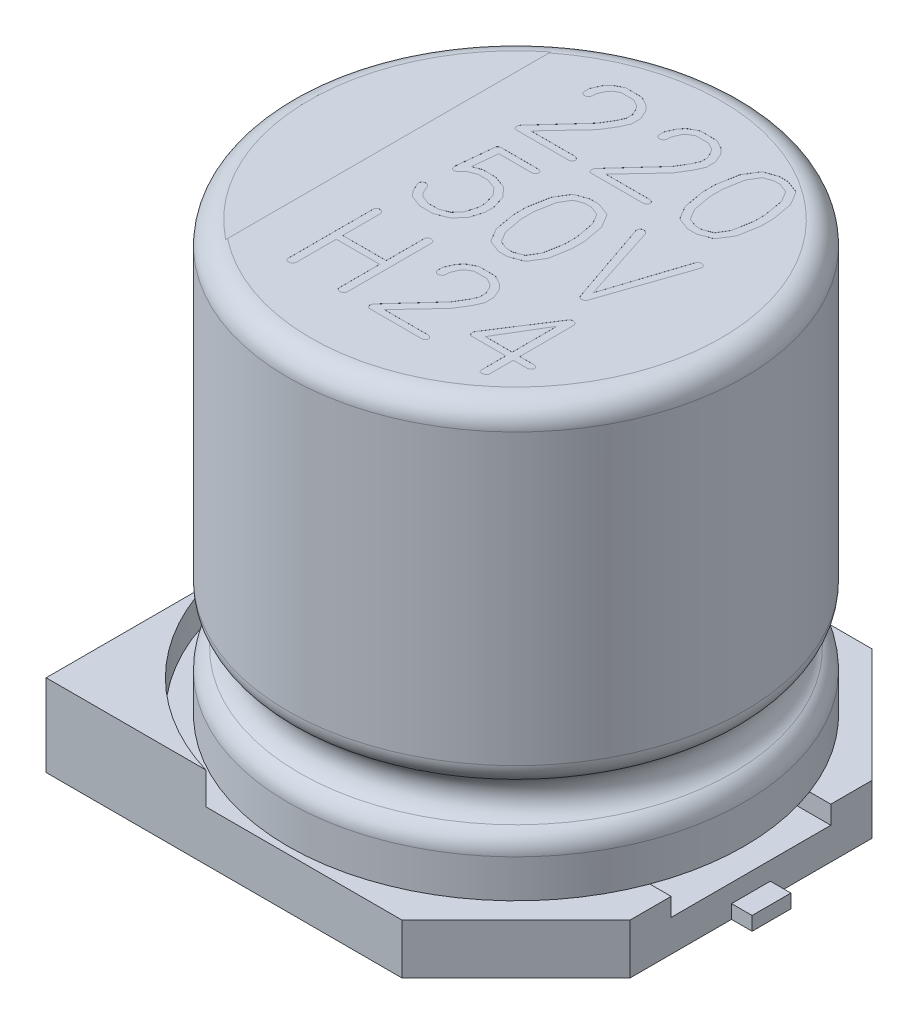
from build123d import *

# Parameters (mm, degrees)
BOSS_EXTRUDE1_DEPTH        = 1.1
BOSS_EXTRUDE2_DEPTH        = 0.7
CUT_EXTRUDE1_DEPTH         = 13.943734136
CUT_EXTRUDE1_DEPTH_BACK    = 13.943734136
SKETCH4_W                  = 3.5
SKETCH4_H                  = 0.4
BOSS_EXTRUDE3_DEPTH        = 0.001
BOSS_EXTRUDE3_DEPTH_BACK   = 0.3
SKETCH5_W                  = 3.35
SKETCH5_H                  = 0.85
BOSS_EXTRUDE3_2_DEPTH      = 0.001
BOSS_EXTRUDE3_2_DEPTH_BACK = 0.3
CUT_EXTRUDE2_START         = -0.001
CUT_EXTRUDE2_DEPTH         = 0.001
CUT_EXTRUDE3_START         = -0.001
CUT_EXTRUDE3_DEPTH         = 0.001


with BuildPart() as part:
    # Sketch1 → Revolve1 (revolve)
    with BuildSketch(Plane(origin=(0, 0, 0), x_dir=(0, 0, -1), z_dir=(1, 0, 0)), mode=Mode.PRIVATE) as revolve1_sk:
        with BuildLine():
            Line((0, 4.590029326), (5, 4.590029326))
            Line((5, 4.590029326), (5, -2.243945271))
            ThreePointArc((5, -2.243945271), (4.933012702, -2.493945271), (4.75, -2.676957973))
            ThreePointArc((4.75, -2.676957973), (4.5, -3.109970674), (4.75, -3.542983376))
            ThreePointArc((4.75, -3.542983376), (4.933012702, -3.725996078), (5, -3.975996078))
            Line((5, -3.975996078), (5, -4.809970674))
            Line((5, -4.809970674), (0, -4.809970674))
            Line((0, -4.809970674), (0, 4.590029326))
        make_face()
    revolve(revolve1_sk.sketch.rotate(Axis((0, 6.950146628, 0), (0, -1, 0)), 180), axis=Axis((0, 6.950146628, 0), (0, -1, 0)))

    # Sketch2 → Boss-Extrude1 (add)
    with BuildSketch(Plane.XZ.offset(4.809970674)):
        Polygon((2.65, 5.15), (5.15, 2.65), (5.15, -2.65), (2.65, -5.15), (-5.15, -5.15), (-5.15, 5.15), align=None)
    extrude(amount=BOSS_EXTRUDE1_DEPTH)

    # Sketch3 → Boss-Extrude2 (add)
    with BuildSketch(Plane(origin=(0, -4.809970674, 0), x_dir=(1, 0, 0), z_dir=(0, 1, 0))):
        with BuildLine():
            Line((-5.15, -5.15), (-1.65, -5.15))
            ThreePointArc((-1.65, -5.15), (-3.843149455, -3.843149455), (-5.15, -1.65))
            Line((-5.15, -1.65), (-5.15, -5.15))
        make_face()
        with BuildLine():
            Line((-5.15, 5.15), (-5.15, 1.65))
            ThreePointArc((-5.15, 1.65), (-3.843149455, 3.843149455), (-1.65, 5.15))
            Line((-1.65, 5.15), (-5.15, 5.15))
        make_face()
    extrude(amount=BOSS_EXTRUDE2_DEPTH)

    # Sketch4 → Cut-Extrude1 (cut, two sides: drawn at the far end of the back side and taken through both)
    with BuildSketch(Plane(origin=(5.15, 0, 0), x_dir=(0, 0, -1), z_dir=(1, 0, 0)).offset(-CUT_EXTRUDE1_DEPTH_BACK)):
        with Locations((0, -5.009970674)):
            Rectangle(SKETCH4_W, SKETCH4_H)
    extrude(amount=CUT_EXTRUDE1_DEPTH + CUT_EXTRUDE1_DEPTH_BACK, mode=Mode.SUBTRACT)

    # Cut-Extrude2: read off the stored shape, not the designer's step
    # Cut-Extrude2 outline → Cut-Extrude2 (cut)
    # profile 1 of 9: a face of its own
    with BuildSketch(Plane(origin=(0, 4.590029326, 0), x_dir=(1, 0, 0), z_dir=(0, 1, 0)).offset(CUT_EXTRUDE2_START)):
        with BuildLine():
            add(Edge.make_bspline(
                [(-1.525982751, 3.564360119), (-1.518792197, 3.571931364), (-1.505299119, 3.586138808), (-1.484513609, 3.604123833), (-1.464752492, 3.617720125), (-1.451181726, 3.6234541), (-1.44488156, 3.626116071)],
                knots=[0, 0, 0, 0, 0.304384541, 0.571177734, 0.800921238, 1, 1, 1, 1], degree=3))
            add(Edge.make_bspline(
                [(-1.592202989, 3.488839286), (-1.58095799, 3.501894963), (-1.559107364, 3.527263992), (-1.536806776, 3.552238335), (-1.525982751, 3.564360119)],
                knots=[0, 0, 0, 0, 0.514630515, 1, 1, 1, 1], degree=3))
            add(Edge.make_bspline(
                [(-1.682232751, 3.287946429), (-1.676555437, 3.300979254), (-1.66409458, 3.329584365), (-1.643126138, 3.375972423), (-1.619055668, 3.430021635), (-1.601537453, 3.468393234), (-1.592202989, 3.488839286)],
                knots=[0, 0, 0, 0, 0.193719621, 0.425185721, 0.69371404, 1, 1, 1, 1], degree=3))
            add(Edge.make_bspline(
                [(-1.684836918, 3.234747024), (-1.684124674, 3.24379513), (-1.682730777, 3.261502755), (-1.682396313, 3.279261776), (-1.682232751, 3.287946429)],
                knots=[0, 0, 0, 0, 0.510972331, 1, 1, 1, 1], degree=3))
            add(Edge.make_bspline(
                [(-1.68409287, 3.204613095), (-1.683599756, 3.20808455), (-1.682174437, 3.218118589), (-1.683784128, 3.228171861), (-1.684836918, 3.234747024)],
                knots=[0, 0, 0, 0, 0.345967863, 1, 1, 1, 1], degree=3))
            add(Edge.make_bspline(
                [(-1.65284287, 3.119047619), (-1.657723365, 3.123647913), (-1.667842725, 3.133186293), (-1.677938691, 3.153188853), (-1.683178097, 3.177549247), (-1.683773361, 3.195160323), (-1.68409287, 3.204613095)],
                knots=[0, 0, 0, 0, 0.212180223, 0.439940561, 0.699387238, 1, 1, 1, 1], degree=3))
            add(Edge.make_bspline(
                [(-1.605595846, 3.102306548), (-1.610700937, 3.102509605), (-1.620143534, 3.102885188), (-1.633281721, 3.105888469), (-1.644512112, 3.11093162), (-1.650117309, 3.11639232), (-1.65284287, 3.119047619)],
                knots=[0, 0, 0, 0, 0.29634935, 0.548140547, 0.78028056, 1, 1, 1, 1], degree=3))
            add(Edge.make_bspline(
                [(-1.563185132, 3.110119048), (-1.57107719, 3.108007272), (-1.585015314, 3.104277677), (-1.599369362, 3.102902898), (-1.605595846, 3.102306548)],
                knots=[0, 0, 0, 0, 0.566221034, 1, 1, 1, 1], degree=3))
            add(Edge.make_bspline(
                [(-1.509613703, 3.194940476), (-1.510196449, 3.186384391), (-1.511338172, 3.169621217), (-1.522430938, 3.14625684), (-1.539548309, 3.125527936), (-1.555037618, 3.115430427), (-1.563185132, 3.110119048)],
                knots=[0, 0, 0, 0, 0.242646645, 0.475395883, 0.724053578, 1, 1, 1, 1], degree=3))
            Line((-1.509613703, 3.194940476), (-1.509613703, 3.261904762))
            Line((-1.509613703, 3.261904762), (-1.441161322, 3.419270833))
            Line((-1.441161322, 3.419270833), (-1.380893465, 3.489583333))
            Line((-1.380893465, 3.489583333), (-1.258497632, 3.55952381))
            Line((-1.258497632, 3.55952381), (-0.982455965, 3.55952381))
            Line((-0.982455965, 3.55952381), (-0.845551203, 3.48735119))
            Line((-0.845551203, 3.48735119), (-0.784167275, 3.417782738))
            Line((-0.784167275, 3.417782738), (-0.714226798, 3.267485119))
            Line((-0.714226798, 3.267485119), (-0.714226798, 3.126488095))
            Line((-0.714226798, 3.126488095), (-0.780447037, 2.981026786))
            Line((-0.780447037, 2.981026786), (-0.935208941, 2.722470238))
            Line((-0.935208941, 2.722470238), (-1.73394406, 1.846354167))
            add(Edge.make_bspline(
                [(-1.761845846, 1.772693452), (-1.761500235, 1.779680605), (-1.76082952, 1.793240312), (-1.755218425, 1.812696808), (-1.746923429, 1.830961574), (-1.738296679, 1.841192276), (-1.73394406, 1.846354167)],
                knots=[0, 0, 0, 0, 0.259643066, 0.503879648, 0.749682982, 1, 1, 1, 1], degree=3))
            add(Edge.make_bspline(
                [(-1.708274418, 1.702380952), (-1.715485601, 1.705010054), (-1.729602386, 1.710156845), (-1.746294159, 1.726112702), (-1.757587406, 1.747500298), (-1.760353552, 1.76386496), (-1.761845846, 1.772693452)],
                knots=[0, 0, 0, 0, 0.242250914, 0.474236155, 0.716358213, 1, 1, 1, 1], degree=3))
            Line((-1.708274418, 1.702380952), (-0.564301203, 1.702380952))
            add(Edge.make_bspline(
                [(-0.486920251, 1.736235119), (-0.49202307, 1.730987703), (-0.502029526, 1.720697698), (-0.52100931, 1.710231599), (-0.541911655, 1.703609028), (-0.556683624, 1.70279878), (-0.564301203, 1.702380952)],
                knots=[0, 0, 0, 0, 0.250947582, 0.492099732, 0.738087023, 1, 1, 1, 1], degree=3))
            add(Edge.make_bspline(
                [(-0.473899418, 1.771205357), (-0.47567381, 1.765593256), (-0.479427973, 1.753719476), (-0.484333372, 1.74227199), (-0.486920251, 1.736235119)],
                knots=[0, 0, 0, 0, 0.472646552, 1, 1, 1, 1], degree=3))
            add(Edge.make_bspline(
                [(-0.553884537, 1.845238095), (-0.547509743, 1.843397621), (-0.53541896, 1.839906878), (-0.51902617, 1.832750331), (-0.505068654, 1.825031046), (-0.493630436, 1.816315211), (-0.484350072, 1.806758168), (-0.478488146, 1.795574246), (-0.474368851, 1.783771334), (-0.474058315, 1.775458779), (-0.473899418, 1.771205357)],
                knots=[0, 0, 0, 0, 0.16865006, 0.319870981, 0.454107496, 0.573381966, 0.685025493, 0.789529921, 0.892305297, 1, 1, 1, 1], degree=3))
            Line((-0.553884537, 1.845238095), (-1.517054179, 1.845238095))
            Line((-1.517054179, 1.845238095), (-0.810952989, 2.598958333))
            Line((-0.810952989, 2.598958333), (-0.635729775, 2.880580357))
            add(Edge.make_bspline(
                [(-0.547560132, 3.077008929), (-0.549418941, 3.072916089), (-0.553641582, 3.063618419), (-0.560814187, 3.04791595), (-0.569159211, 3.028544006), (-0.579891058, 3.005979208), (-0.591093973, 2.979431696), (-0.604668253, 2.949625493), (-0.619927133, 2.916382219), (-0.63030468, 2.892871244), (-0.635729775, 2.880580357)],
                knots=[0, 0, 0, 0, 0.062632263, 0.142281181, 0.240524556, 0.356495132, 0.49035439, 0.641931264, 0.812811584, 1, 1, 1, 1], degree=3))
            Line((-0.547560132, 3.077008929), (-0.547560132, 3.279761905))
            add(Edge.make_bspline(
                [(-0.616384537, 3.433779762), (-0.612397856, 3.425355804), (-0.603046302, 3.405595734), (-0.587542538, 3.371491755), (-0.568513894, 3.328606904), (-0.554961834, 3.297015901), (-0.547560132, 3.279761905)],
                knots=[0, 0, 0, 0, 0.165723618, 0.388737769, 0.666148108, 1, 1, 1, 1], degree=3))
            add(Edge.make_bspline(
                [(-0.739896441, 3.594866071), (-0.725998603, 3.579994215), (-0.699633651, 3.5517815), (-0.667792007, 3.517463885), (-0.645812578, 3.491334521), (-0.632641459, 3.472476206), (-0.622694925, 3.453326001), (-0.618447792, 3.440170634), (-0.616384537, 3.433779762)],
                knots=[0, 0, 0, 0, 0.298097896, 0.565507836, 0.685490914, 0.797822104, 0.901782062, 1, 1, 1, 1], degree=3))
            add(Edge.make_bspline(
                [(-0.937813108, 3.699776786), (-0.925814412, 3.693148113), (-0.898860864, 3.678257641), (-0.853426884, 3.654986195), (-0.799904874, 3.625792189), (-0.760900345, 3.605690703), (-0.739896441, 3.594866071)],
                knots=[0, 0, 0, 0, 0.183571618, 0.412370331, 0.683561953, 1, 1, 1, 1], degree=3))
            Line((-0.937813108, 3.699776786), (-1.291235727, 3.702380952))
            Line((-1.291235727, 3.702380952), (-1.310208941, 3.697916667))
            Line((-1.310208941, 3.697916667), (-1.44488156, 3.626116071))
        make_face()
    # profile 2 of 9: a face of its own
    with BuildSketch(Plane(origin=(0, 4.590029326, 0), x_dir=(1, 0, 0), z_dir=(0, 1, 0)).offset(CUT_EXTRUDE2_START)):
        with BuildLine():
            add(Edge.make_bspline(
                [(1.597529154, 1.202380952), (1.605195092, 1.201510642), (1.622143174, 1.199586533), (1.646358587, 1.188080402), (1.67011832, 1.174226748), (1.681770823, 1.160430388), (1.687186892, 1.154017857)],
                knots=[0, 0, 0, 0, 0.219777699, 0.485891046, 0.761042784, 1, 1, 1, 1], degree=3))
            add(Edge.make_bspline(
                [(1.539121416, 1.172991071), (1.544309427, 1.177537286), (1.553942879, 1.185979007), (1.569484449, 1.19479509), (1.583667679, 1.20110787), (1.593136367, 1.201977505), (1.597529154, 1.202380952)],
                knots=[0, 0, 0, 0, 0.30946402, 0.57463379, 0.802660857, 1, 1, 1, 1], degree=3))
            add(Edge.make_bspline(
                [(1.52386844, 1.105282738), (1.524130035, 1.11248228), (1.524619039, 1.125940486), (1.52691803, 1.144626949), (1.531585828, 1.160367985), (1.536724779, 1.168976393), (1.539121416, 1.172991071)],
                knots=[0, 0, 0, 0, 0.307017789, 0.573912696, 0.801286922, 1, 1, 1, 1], degree=3))
            Line((1.52386844, 1.105282738), (2.158169035, -0.74702381))
            add(Edge.make_bspline(
                [(2.224017249, -0.797619048), (2.216460088, -0.797010799), (2.20205104, -0.795851067), (2.182322329, -0.785791574), (2.167354362, -0.768774483), (2.161355039, -0.754568205), (2.158169035, -0.74702381)],
                knots=[0, 0, 0, 0, 0.253352165, 0.483060193, 0.725473614, 1, 1, 1, 1], degree=3))
            add(Edge.make_bspline(
                [(2.314791059, -0.757068452), (2.310465235, -0.763400703), (2.301690122, -0.776245937), (2.280307872, -0.789119586), (2.253886165, -0.796338004), (2.234489174, -0.797169919), (2.224017249, -0.797619048)],
                knots=[0, 0, 0, 0, 0.218396189, 0.443025726, 0.699304239, 1, 1, 1, 1], degree=3))
            Line((2.314791059, -0.757068452), (2.952439868, 1.110491071))
            add(Edge.make_bspline(
                [(2.946487487, 1.154761905), (2.948044496, 1.14834097), (2.951569676, 1.133803515), (2.952128094, 1.118843509), (2.952439868, 1.110491071)],
                knots=[0, 0, 0, 0, 0.441682214, 1, 1, 1, 1], degree=3))
            add(Edge.make_bspline(
                [(2.859433916, 1.202380952), (2.869694146, 1.200353859), (2.888646636, 1.196609453), (2.913962183, 1.186614364), (2.933954346, 1.172976167), (2.942451351, 1.160627573), (2.946487487, 1.154761905)],
                knots=[0, 0, 0, 0, 0.305527952, 0.564365036, 0.79307036, 1, 1, 1, 1], degree=3))
            add(Edge.make_bspline(
                [(2.792841654, 1.162574405), (2.796736024, 1.167594245), (2.804488034, 1.177586583), (2.819929252, 1.189522655), (2.838669358, 1.197619325), (2.852301498, 1.200745381), (2.859433916, 1.202380952)],
                knots=[0, 0, 0, 0, 0.238342879, 0.47443784, 0.725022705, 1, 1, 1, 1], degree=3))
            Line((2.792841654, 1.162574405), (2.237410106, -0.545386905))
            Line((2.237410106, -0.545386905), (1.687186892, 1.154017857))
        make_face()
    # profile 3 of 9: a face of its own
    with BuildSketch(Plane(origin=(0, 4.590029326, 0), x_dir=(1, 0, 0), z_dir=(0, 1, 0)).offset(CUT_EXTRUDE2_START)):
        with BuildLine():
            add(Edge.make_bspline(
                [(-1.701577989, -1.297619048), (-1.690169834, -1.298073941), (-1.668613436, -1.298933488), (-1.639174756, -1.310487714), (-1.614310855, -1.3283019), (-1.603374149, -1.345171148), (-1.597783346, -1.353794643)],
                knots=[0, 0, 0, 0, 0.274120724, 0.51796769, 0.753586925, 1, 1, 1, 1], degree=3))
            add(Edge.make_bspline(
                [(-1.761845846, -1.354910714), (-1.759259558, -1.347410478), (-1.754326272, -1.333103947), (-1.740941571, -1.315187299), (-1.722755878, -1.302929439), (-1.708810879, -1.299432707), (-1.701577989, -1.297619048)],
                knots=[0, 0, 0, 0, 0.269047248, 0.513201498, 0.747510944, 1, 1, 1, 1], degree=3))
            Line((-1.761845846, -1.354910714), (-1.761845846, -3.226190476))
            add(Edge.make_bspline(
                [(-1.690417275, -3.297619048), (-1.695666157, -3.297501573), (-1.705846431, -3.29727373), (-1.719935274, -3.292780938), (-1.732852484, -3.287050415), (-1.743164701, -3.277857726), (-1.751481187, -3.266958614), (-1.75737777, -3.254521201), (-1.761389834, -3.240820686), (-1.761690288, -3.231181233), (-1.761845846, -3.226190476)],
                knots=[0, 0, 0, 0, 0.137708227, 0.267086899, 0.387027622, 0.507635305, 0.626680935, 0.746621658, 0.868815193, 1, 1, 1, 1], degree=3))
            Line((-1.690417275, -3.297619048), (-1.657679179, -3.297619048))
            add(Edge.make_bspline(
                [(-1.595179179, -3.231026786), (-1.597180704, -3.237405572), (-1.601375044, -3.250772782), (-1.61539806, -3.268197488), (-1.634005295, -3.284674682), (-1.649401673, -3.293093087), (-1.657679179, -3.297619048)],
                knots=[0, 0, 0, 0, 0.211346888, 0.442892777, 0.700484198, 1, 1, 1, 1], degree=3))
            Line((-1.595179179, -3.231026786), (-1.595179179, -2.345238095))
            Line((-1.595179179, -2.345238095), (-0.642798227, -2.345238095))
            Line((-0.642798227, -2.345238095), (-0.642798227, -3.2265625))
            add(Edge.make_bspline(
                [(-0.571369656, -3.297619048), (-0.576227066, -3.297437827), (-0.585724303, -3.297083502), (-0.599364672, -3.293336302), (-0.611497026, -3.286601792), (-0.622714063, -3.278350461), (-0.631683762, -3.267437007), (-0.637913527, -3.254917829), (-0.642443211, -3.241253452), (-0.642677409, -3.231562074), (-0.642798227, -3.2265625)],
                knots=[0, 0, 0, 0, 0.129077934, 0.252373937, 0.371948458, 0.496693245, 0.620913156, 0.743411691, 0.867631603, 1, 1, 1, 1], degree=3))
            Line((-0.571369656, -3.297619048), (-0.537143465, -3.297619048))
            add(Edge.make_bspline(
                [(-0.47613156, -3.22953869), (-0.478100429, -3.236532144), (-0.48208727, -3.250693468), (-0.495574926, -3.269239906), (-0.51413073, -3.285296881), (-0.52913339, -3.293330054), (-0.537143465, -3.297619048)],
                knots=[0, 0, 0, 0, 0.228487027, 0.462672527, 0.713115322, 1, 1, 1, 1], degree=3))
            Line((-0.47613156, -3.22953869), (-0.47613156, -1.367931548))
            Line((-0.47613156, -1.367931548), (-0.483200013, -1.34375))
            add(Edge.make_bspline(
                [(-0.584018465, -1.297619048), (-0.57104476, -1.298070771), (-0.547837089, -1.298878825), (-0.517149419, -1.307066618), (-0.493736317, -1.321669243), (-0.486612925, -1.336597617), (-0.483200013, -1.34375)],
                knots=[0, 0, 0, 0, 0.32842445, 0.587493402, 0.802362594, 1, 1, 1, 1], degree=3))
            add(Edge.make_bspline(
                [(-0.642798227, -1.355654762), (-0.639957864, -1.348130927), (-0.634544214, -1.333790713), (-0.620761457, -1.316441287), (-0.604009111, -1.303343255), (-0.590790358, -1.29955814), (-0.584018465, -1.297619048)],
                knots=[0, 0, 0, 0, 0.276965208, 0.527887771, 0.758139562, 1, 1, 1, 1], degree=3))
            Line((-0.642798227, -1.355654762), (-0.642798227, -2.202380952))
            Line((-0.642798227, -2.202380952), (-1.595179179, -2.202380952))
            Line((-1.595179179, -2.202380952), (-1.595179179, -1.373511905))
            Line((-1.595179179, -1.373511905), (-1.597783346, -1.353794643))
        make_face()
    # profile 4 of 9: a face of its own
    with BuildSketch(Plane(origin=(0, 4.590029326, 0), x_dir=(1, 0, 0), z_dir=(0, 1, 0)).offset(CUT_EXTRUDE2_START)):
        with BuildLine():
            add(Edge.make_bspline(
                [(0.259731535, -1.435639881), (0.266922089, -1.428068636), (0.280415167, -1.413861192), (0.301200677, -1.395876167), (0.320961794, -1.382279875), (0.33453256, -1.3765459), (0.340832725, -1.373883929)],
                knots=[0, 0, 0, 0, 0.304384541, 0.571177734, 0.800921238, 1, 1, 1, 1], degree=3))
            add(Edge.make_bspline(
                [(0.193511297, -1.511160714), (0.204756296, -1.498105037), (0.226606921, -1.472736008), (0.24890751, -1.447761665), (0.259731535, -1.435639881)],
                knots=[0, 0, 0, 0, 0.514630515, 1, 1, 1, 1], degree=3))
            add(Edge.make_bspline(
                [(0.103481535, -1.712053571), (0.109158848, -1.699020746), (0.121619706, -1.670415635), (0.142588147, -1.624027577), (0.166658617, -1.569978365), (0.184176832, -1.531606766), (0.193511297, -1.511160714)],
                knots=[0, 0, 0, 0, 0.193719621, 0.425185721, 0.69371404, 1, 1, 1, 1], degree=3))
            add(Edge.make_bspline(
                [(0.100877368, -1.765252976), (0.101589611, -1.75620487), (0.102983509, -1.738497245), (0.103317973, -1.720738224), (0.103481535, -1.712053571)],
                knots=[0, 0, 0, 0, 0.510972331, 1, 1, 1, 1], degree=3))
            add(Edge.make_bspline(
                [(0.101621416, -1.795386905), (0.10211453, -1.79191545), (0.103539849, -1.781881411), (0.101930158, -1.771828139), (0.100877368, -1.765252976)],
                knots=[0, 0, 0, 0, 0.345967863, 1, 1, 1, 1], degree=3))
            add(Edge.make_bspline(
                [(0.132871416, -1.880952381), (0.12799092, -1.876352087), (0.117871561, -1.866813707), (0.107775594, -1.846811147), (0.102536189, -1.822450753), (0.101940925, -1.804839677), (0.101621416, -1.795386905)],
                knots=[0, 0, 0, 0, 0.212180223, 0.439940561, 0.699387238, 1, 1, 1, 1], degree=3))
            add(Edge.make_bspline(
                [(0.18011844, -1.897693452), (0.175013348, -1.897490395), (0.165570751, -1.897114812), (0.152432564, -1.894111531), (0.141202174, -1.88906838), (0.135596977, -1.88360768), (0.132871416, -1.880952381)],
                knots=[0, 0, 0, 0, 0.29634935, 0.548140547, 0.78028056, 1, 1, 1, 1], degree=3))
            add(Edge.make_bspline(
                [(0.222529154, -1.889880952), (0.214637095, -1.891992728), (0.200698972, -1.895722323), (0.186344924, -1.897097102), (0.18011844, -1.897693452)],
                knots=[0, 0, 0, 0, 0.566221034, 1, 1, 1, 1], degree=3))
            add(Edge.make_bspline(
                [(0.276100582, -1.805059524), (0.275517836, -1.813615609), (0.274376114, -1.830378783), (0.263283347, -1.85374316), (0.246165976, -1.874472064), (0.230676668, -1.884569573), (0.222529154, -1.889880952)],
                knots=[0, 0, 0, 0, 0.242646645, 0.475395883, 0.724053578, 1, 1, 1, 1], degree=3))
            Line((0.276100582, -1.805059524), (0.276100582, -1.738095238))
            Line((0.276100582, -1.738095238), (0.344552963, -1.580729167))
            Line((0.344552963, -1.580729167), (0.404820821, -1.510416667))
            Line((0.404820821, -1.510416667), (0.527216654, -1.44047619))
            Line((0.527216654, -1.44047619), (0.803258321, -1.44047619))
            Line((0.803258321, -1.44047619), (0.940163082, -1.51264881))
            Line((0.940163082, -1.51264881), (1.001547011, -1.582217262))
            Line((1.001547011, -1.582217262), (1.071487487, -1.732514881))
            Line((1.071487487, -1.732514881), (1.071487487, -1.873511905))
            Line((1.071487487, -1.873511905), (1.005267249, -2.018973214))
            Line((1.005267249, -2.018973214), (0.850505344, -2.277529762))
            Line((0.850505344, -2.277529762), (0.051770225, -3.153645833))
            add(Edge.make_bspline(
                [(0.02386844, -3.227306548), (0.024214051, -3.220319395), (0.024884766, -3.206759688), (0.030495861, -3.187303192), (0.038790856, -3.169038426), (0.047417607, -3.158807724), (0.051770225, -3.153645833)],
                knots=[0, 0, 0, 0, 0.259643066, 0.503879648, 0.749682982, 1, 1, 1, 1], degree=3))
            add(Edge.make_bspline(
                [(0.077439868, -3.297619048), (0.070228684, -3.294989946), (0.0561119, -3.289843155), (0.039420127, -3.273887298), (0.028126879, -3.252499702), (0.025360734, -3.23613504), (0.02386844, -3.227306548)],
                knots=[0, 0, 0, 0, 0.242250914, 0.474236155, 0.716358213, 1, 1, 1, 1], degree=3))
            Line((0.077439868, -3.297619048), (1.221413082, -3.297619048))
            add(Edge.make_bspline(
                [(1.298794035, -3.263764881), (1.293691216, -3.269012297), (1.28368476, -3.279302302), (1.264704976, -3.289768401), (1.243802631, -3.296390972), (1.229030662, -3.29720122), (1.221413082, -3.297619048)],
                knots=[0, 0, 0, 0, 0.250947582, 0.492099732, 0.738087023, 1, 1, 1, 1], degree=3))
            add(Edge.make_bspline(
                [(1.311814868, -3.228794643), (1.310040476, -3.234406744), (1.306286312, -3.246280524), (1.301380914, -3.25772801), (1.298794035, -3.263764881)],
                knots=[0, 0, 0, 0, 0.472646552, 1, 1, 1, 1], degree=3))
            add(Edge.make_bspline(
                [(1.231829749, -3.154761905), (1.238204542, -3.156602379), (1.250295326, -3.160093122), (1.266688115, -3.167249669), (1.280645632, -3.174968954), (1.29208385, -3.183684789), (1.301364214, -3.193241832), (1.307226139, -3.204425754), (1.311345435, -3.216228666), (1.311655971, -3.224541221), (1.311814868, -3.228794643)],
                knots=[0, 0, 0, 0, 0.16865006, 0.319870981, 0.454107496, 0.573381966, 0.685025493, 0.789529921, 0.892305297, 1, 1, 1, 1], degree=3))
            Line((1.231829749, -3.154761905), (0.268660106, -3.154761905))
            Line((0.268660106, -3.154761905), (0.974761297, -2.401041667))
            Line((0.974761297, -2.401041667), (1.149984511, -2.119419643))
            add(Edge.make_bspline(
                [(1.238154154, -1.922991071), (1.236295345, -1.927083911), (1.232072704, -1.936381581), (1.224900099, -1.95208405), (1.216555075, -1.971455994), (1.205823228, -1.994020792), (1.194620313, -2.020568304), (1.181046033, -2.050374507), (1.165787153, -2.083617781), (1.155409605, -2.107128756), (1.149984511, -2.119419643)],
                knots=[0, 0, 0, 0, 0.062632263, 0.142281181, 0.240524556, 0.356495132, 0.49035439, 0.641931264, 0.812811584, 1, 1, 1, 1], degree=3))
            Line((1.238154154, -1.922991071), (1.238154154, -1.720238095))
            add(Edge.make_bspline(
                [(1.169329749, -1.566220238), (1.17331643, -1.574644196), (1.182667984, -1.594404266), (1.198171747, -1.628508245), (1.217200392, -1.671393096), (1.230752452, -1.702984099), (1.238154154, -1.720238095)],
                knots=[0, 0, 0, 0, 0.165723618, 0.388737769, 0.666148108, 1, 1, 1, 1], degree=3))
            add(Edge.make_bspline(
                [(1.045817844, -1.405133929), (1.059715683, -1.420005785), (1.086080635, -1.4482185), (1.117922279, -1.482536115), (1.139901708, -1.508665479), (1.153072827, -1.527523794), (1.16301936, -1.546673999), (1.167266494, -1.559829366), (1.169329749, -1.566220238)],
                knots=[0, 0, 0, 0, 0.298097896, 0.565507836, 0.685490914, 0.797822104, 0.901782062, 1, 1, 1, 1], degree=3))
            add(Edge.make_bspline(
                [(0.847901178, -1.300223214), (0.859899874, -1.306851887), (0.886853422, -1.321742359), (0.932287402, -1.345013805), (0.985809411, -1.374207811), (1.024813941, -1.394309297), (1.045817844, -1.405133929)],
                knots=[0, 0, 0, 0, 0.183571618, 0.412370331, 0.683561953, 1, 1, 1, 1], degree=3))
            Line((0.847901178, -1.300223214), (0.494478559, -1.297619048))
            Line((0.494478559, -1.297619048), (0.475505344, -1.302083333))
            Line((0.475505344, -1.302083333), (0.340832725, -1.373883929))
        make_face()
    # profile 5 of 9: a face of its own
    with BuildSketch(Plane(origin=(0, 4.590029326, 0), x_dir=(1, 0, 0), z_dir=(0, 1, 0)).offset(CUT_EXTRUDE2_START)):
        with BuildLine():
            add(Edge.make_bspline(
                [(2.567023202, -1.301339286), (2.575435415, -1.303393494), (2.590708377, -1.307123053), (2.610383599, -1.316396685), (2.625007323, -1.328396646), (2.629837523, -1.338812278), (2.632127368, -1.34375)],
                knots=[0, 0, 0, 0, 0.319425048, 0.579938577, 0.800862167, 1, 1, 1, 1], degree=3))
            add(Edge.make_bspline(
                [(2.544329749, -1.297619048), (2.548067821, -1.297881172), (2.555746168, -1.298419601), (2.563198771, -1.30034912), (2.567023202, -1.301339286)],
                knots=[0, 0, 0, 0, 0.486832981, 1, 1, 1, 1], degree=3))
            add(Edge.make_bspline(
                [(2.490014273, -1.321056548), (2.494607941, -1.31739814), (2.503249464, -1.31051601), (2.517381753, -1.303514123), (2.53085311, -1.298538959), (2.539950232, -1.297917992), (2.544329749, -1.297619048)],
                knots=[0, 0, 0, 0, 0.291422228, 0.548218157, 0.782504151, 1, 1, 1, 1], degree=3))
            Line((2.490014273, -1.321056548), (1.777216654, -2.424479167))
            Line((1.777216654, -2.424479167), (1.682722606, -2.569196429))
            add(Edge.make_bspline(
                [(1.666725582, -2.622395833), (1.667460124, -2.61303076), (1.668941442, -2.594144629), (1.678103661, -2.577558159), (1.682722606, -2.569196429)],
                knots=[0, 0, 0, 0, 0.495870391, 1, 1, 1, 1], degree=3))
            Line((1.666725582, -2.622395833), (1.667097606, -2.641741071))
            add(Edge.make_bspline(
                [(1.72996963, -2.702380952), (1.722336809, -2.70063445), (1.707606372, -2.697263908), (1.688780793, -2.684101195), (1.674719306, -2.665148629), (1.669750255, -2.649887814), (1.667097606, -2.641741071)],
                knots=[0, 0, 0, 0, 0.250968066, 0.484338532, 0.724722342, 1, 1, 1, 1], degree=3))
            Line((1.72996963, -2.702380952), (2.476249392, -2.702380952))
            Line((2.476249392, -2.702380952), (2.476249392, -3.227306548))
            add(Edge.make_bspline(
                [(2.547677963, -3.297619048), (2.542080765, -3.29743092), (2.531516196, -3.297075834), (2.516709512, -3.293767171), (2.504242461, -3.288106724), (2.493593115, -3.280556372), (2.485833885, -3.270183129), (2.480031831, -3.257808551), (2.476833133, -3.243213319), (2.476450159, -3.232777395), (2.476249392, -3.227306548)],
                knots=[0, 0, 0, 0, 0.146120685, 0.275799037, 0.393243869, 0.502107596, 0.612930406, 0.727433559, 0.857111911, 1, 1, 1, 1], degree=3))
            add(Edge.make_bspline(
                [(2.642916059, -3.230282738), (2.641079136, -3.236228551), (2.637539625, -3.247685357), (2.627894907, -3.262605388), (2.615302097, -3.274614836), (2.595735182, -3.284698298), (2.573227349, -3.293343301), (2.555296368, -3.296344091), (2.547677963, -3.297619048)],
                knots=[0, 0, 0, 0, 0.149231329, 0.287549313, 0.422738116, 0.56310347, 0.814374114, 1, 1, 1, 1], degree=3))
            Line((2.642916059, -3.230282738), (2.642916059, -2.702380952))
            Line((2.642916059, -2.702380952), (2.958764273, -2.702380952))
            Line((2.958764273, -2.702380952), (2.986666059, -2.692708333))
            add(Edge.make_bspline(
                [(3.034285106, -2.619047619), (3.033695094, -2.626200485), (3.032522236, -2.640419329), (3.023345797, -2.660842745), (3.007386254, -2.678460873), (2.993833201, -2.687780118), (2.986666059, -2.692708333)],
                knots=[0, 0, 0, 0, 0.233231212, 0.463629264, 0.716355746, 1, 1, 1, 1], degree=3))
            add(Edge.make_bspline(
                [(2.954672011, -2.559895833), (2.965470744, -2.561873429), (2.985185017, -2.565483748), (3.01074384, -2.577495638), (3.028192263, -2.596202576), (3.032258537, -2.61144902), (3.034285106, -2.619047619)],
                knots=[0, 0, 0, 0, 0.307809079, 0.561939283, 0.781677093, 1, 1, 1, 1], degree=3))
            Line((2.954672011, -2.559895833), (2.642916059, -2.55952381))
            Line((2.642916059, -2.55952381), (2.642916059, -1.372395833))
            Line((2.642916059, -1.372395833), (2.632127368, -1.34375))
        make_face()
        Polygon((1.887707725, -2.55952381), (2.476249392, -1.578125), (2.476249392, -2.55952381), align=None, mode=Mode.SUBTRACT)
    # profile 6 of 9: a face of its own
    with BuildSketch(Plane(origin=(0, 4.590029326, 0), x_dir=(1, 0, 0), z_dir=(0, 1, 0)).offset(CUT_EXTRUDE2_START)):
        with BuildLine():
            add(Edge.make_bspline(
                [(0.157052963, 1.10639881), (0.165864418, 1.109229974), (0.185017826, 1.115384061), (0.216147091, 1.125924002), (0.252120092, 1.138548748), (0.29143613, 1.152802089), (0.330546948, 1.167729843), (0.366736381, 1.180379758), (0.397529644, 1.192234398), (0.416587686, 1.198946712), (0.42528213, 1.202008929)],
                knots=[0, 0, 0, 0, 0.097494295, 0.211922795, 0.346195072, 0.499096622, 0.652449514, 0.787159544, 0.902900332, 1, 1, 1, 1], degree=3))
            Line((0.157052963, 1.10639881), (0.136963678, 1.087425595))
            Line((0.136963678, 1.087425595), (-0.028958941, 0.819568452))
            Line((-0.028958941, 0.819568452), (-0.038259537, 0.797991071))
            Line((-0.038259537, 0.797991071), (-0.118988703, 0.350074405))
            Line((-0.118988703, 0.350074405), (-0.118988703, 0.062872024))
            Line((-0.118988703, 0.062872024), (-0.039375608, -0.383184524))
            Line((-0.039375608, -0.383184524), (-0.032679179, -0.404017857))
            Line((-0.032679179, -0.404017857), (0.132127368, -0.680803571))
            Line((0.132127368, -0.680803571), (0.154448797, -0.701264881))
            add(Edge.make_bspline(
                [(0.413377368, -0.797619048), (0.405556448, -0.794914514), (0.389134217, -0.789235583), (0.363285859, -0.779740427), (0.334820341, -0.769508299), (0.303759318, -0.757798805), (0.270170037, -0.745229261), (0.233742027, -0.731838215), (0.194957871, -0.716997359), (0.168209091, -0.706608956), (0.154448797, -0.701264881)],
                knots=[0, 0, 0, 0, 0.089853612, 0.188673046, 0.298996415, 0.418297397, 0.549102946, 0.688419437, 0.839714544, 1, 1, 1, 1], degree=3))
            Line((0.413377368, -0.797619048), (0.616874392, -0.797619048))
            add(Edge.make_bspline(
                [(0.885847606, -0.698660714), (0.875536511, -0.701828188), (0.853828606, -0.708496658), (0.819908363, -0.720227868), (0.782875079, -0.733422269), (0.74438905, -0.748479631), (0.706666116, -0.762798309), (0.672352909, -0.775718318), (0.643037806, -0.787320898), (0.62505981, -0.794397195), (0.616874392, -0.797619048)],
                knots=[0, 0, 0, 0, 0.112872702, 0.237630425, 0.375556633, 0.524258636, 0.670072947, 0.797812071, 0.907943434, 1, 1, 1, 1], degree=3))
            Line((0.885847606, -0.698660714), (0.90184463, -0.685639881))
            Line((0.90184463, -0.685639881), (1.074835702, -0.410714286))
            Line((1.074835702, -0.410714286), (1.087112487, -0.386160714))
            Line((1.087112487, -0.386160714), (1.166725582, 0.05766369))
            Line((1.166725582, 0.05766369), (1.166725582, 0.333333333))
            Line((1.166725582, 0.333333333), (1.087112487, 0.777157738))
            Line((1.087112487, 0.777157738), (1.077439868, 0.803571429))
            Line((1.077439868, 0.803571429), (0.917097606, 1.0703125))
            Line((0.917097606, 1.0703125), (0.891799987, 1.09858631))
            add(Edge.make_bspline(
                [(0.620222606, 1.199032738), (0.627775471, 1.196026315), (0.643824223, 1.189638099), (0.669862465, 1.18003215), (0.698885033, 1.168802146), (0.731353043, 1.157045892), (0.766774399, 1.143903747), (0.805476501, 1.129797822), (0.847512301, 1.114536767), (0.876668595, 1.104035965), (0.891799987, 1.09858631)],
                knots=[0, 0, 0, 0, 0.084217719, 0.178950538, 0.287518157, 0.406613068, 0.536684742, 0.678939248, 0.833377444, 1, 1, 1, 1], degree=3))
            Line((0.620222606, 1.199032738), (0.42528213, 1.202008929))
        make_face()
        Polygon((1.000058916, 0.072544643), (0.92528213, -0.348958333), (0.785773202, -0.578497024), (0.583764273, -0.654761905), (0.444627368, -0.654761905), (0.263823797, -0.586681548), (0.124686892, -0.355282738), (0.047677963, 0.069568452), (0.047677963, 0.341889881), (0.123198797, 0.764136905), (0.26121963, 0.990699405), (0.447231535, 1.05952381), (0.584880344, 1.05952381), (0.783913082, 0.98735119), (0.922677963, 0.756324405), (1.000058916, 0.321056548), align=None, mode=Mode.SUBTRACT)
    # profile 7 of 9: a face of its own
    with BuildSketch(Plane(origin=(0, 4.590029326, 0), x_dir=(1, 0, 0), z_dir=(0, 1, 0)).offset(CUT_EXTRUDE2_START)):
        with BuildLine():
            add(Edge.make_bspline(
                [(-1.600387513, 1.143229167), (-1.599121975, 1.149980129), (-1.596627001, 1.163289471), (-1.584213642, 1.180750355), (-1.565603758, 1.194417125), (-1.550248422, 1.199593527), (-1.541979775, 1.202380952)],
                knots=[0, 0, 0, 0, 0.230250674, 0.453933059, 0.705950109, 1, 1, 1, 1], degree=3))
            Line((-1.600387513, 1.143229167), (-1.684836918, 0.325892857))
            Line((-1.684836918, 0.325892857), (-1.676652394, 0.296130952))
            add(Edge.make_bspline(
                [(-1.624197037, 0.248511905), (-1.630132069, 0.250898585), (-1.641696387, 0.255548995), (-1.656947786, 0.266052385), (-1.668866199, 0.279851634), (-1.674034505, 0.290657489), (-1.676652394, 0.296130952)],
                knots=[0, 0, 0, 0, 0.261872693, 0.510254856, 0.751930596, 1, 1, 1, 1], degree=3))
            add(Edge.make_bspline(
                [(-1.547560132, 0.264136905), (-1.551439983, 0.261707205), (-1.560269642, 0.25617776), (-1.577622488, 0.251994118), (-1.599282433, 0.249048158), (-1.615374274, 0.248701803), (-1.624197037, 0.248511905)],
                knots=[0, 0, 0, 0, 0.172235807, 0.391969579, 0.666631786, 1, 1, 1, 1], degree=3))
            Line((-1.547560132, 0.264136905), (-1.461994656, 0.365699405))
            Line((-1.461994656, 0.365699405), (-1.27300656, 0.44047619))
            Line((-1.27300656, 0.44047619), (-1.060208941, 0.44047619))
            Line((-1.060208941, 0.44047619), (-0.847411322, 0.361979167))
            Line((-0.847411322, 0.361979167), (-0.713110727, 0.211309524))
            Line((-0.713110727, 0.211309524), (-0.642798227, -0.028645833))
            Line((-0.642798227, -0.028645833), (-0.642798227, -0.183407738))
            Line((-0.642798227, -0.183407738), (-0.71534287, -0.425967262))
            Line((-0.71534287, -0.425967262), (-0.849643465, -0.577008929))
            Line((-0.849643465, -0.577008929), (-1.05425656, -0.654761905))
            Line((-1.05425656, -0.654761905), (-1.27300656, -0.654761905))
            Line((-1.27300656, -0.654761905), (-1.462738703, -0.582589286))
            Line((-1.462738703, -0.582589286), (-1.521890489, -0.517857143))
            Line((-1.521890489, -0.517857143), (-1.594435132, -0.351190476))
            add(Edge.make_bspline(
                [(-1.664747632, -0.295014881), (-1.656192627, -0.298347727), (-1.640252986, -0.304557467), (-1.619490457, -0.317233336), (-1.603776703, -0.332768732), (-1.597491167, -0.345163921), (-1.594435132, -0.351190476)],
                knots=[0, 0, 0, 0, 0.296626607, 0.552673144, 0.782509187, 1, 1, 1, 1], degree=3))
            add(Edge.make_bspline(
                [(-1.742872632, -0.319940476), (-1.737540532, -0.316130124), (-1.726814291, -0.308465085), (-1.707944674, -0.300652363), (-1.687079262, -0.295702598), (-1.672342326, -0.295248764), (-1.664747632, -0.295014881)],
                knots=[0, 0, 0, 0, 0.234598074, 0.471925834, 0.727856446, 1, 1, 1, 1], degree=3))
            add(Edge.make_bspline(
                [(-1.761845846, -0.373883929), (-1.761673771, -0.368649803), (-1.761337163, -0.358410941), (-1.757504453, -0.343932273), (-1.751568465, -0.330829219), (-1.745761551, -0.323557921), (-1.742872632, -0.319940476)],
                knots=[0, 0, 0, 0, 0.267945949, 0.524149023, 0.763265871, 1, 1, 1, 1], degree=3))
            Line((-1.761845846, -0.373883929), (-1.761845846, -0.395089286))
            Line((-1.761845846, -0.395089286), (-1.671072037, -0.589657738))
            add(Edge.make_bspline(
                [(-1.562813108, -0.702752976), (-1.564574671, -0.701292353), (-1.569038349, -0.697591238), (-1.576258952, -0.689903803), (-1.586364907, -0.680051104), (-1.598696397, -0.667321197), (-1.613086176, -0.651592774), (-1.630225945, -0.633387677), (-1.65004524, -0.61264208), (-1.663785696, -0.59762242), (-1.671072037, -0.589657738)],
                knots=[0, 0, 0, 0, 0.043802275, 0.110991898, 0.201697889, 0.314253043, 0.450405316, 0.610060218, 0.793221274, 1, 1, 1, 1], degree=3))
            add(Edge.make_bspline(
                [(-1.310208941, -0.797619048), (-1.317794087, -0.795072263), (-1.333787242, -0.78970241), (-1.358715449, -0.779971996), (-1.386632927, -0.770394424), (-1.416750195, -0.758398816), (-1.44978164, -0.746450929), (-1.48527682, -0.733002113), (-1.523066301, -0.717964723), (-1.549284318, -0.707930663), (-1.562813108, -0.702752976)],
                knots=[0, 0, 0, 0, 0.088940656, 0.187529925, 0.29742365, 0.416991922, 0.547853359, 0.687912087, 0.838959148, 1, 1, 1, 1], degree=3))
            Line((-1.310208941, -0.797619048), (-1.025238703, -0.797619048))
            add(Edge.make_bspline(
                [(-0.748825013, -0.692708333), (-0.759478011, -0.697077442), (-0.781828277, -0.706243944), (-0.817124465, -0.720023592), (-0.855737199, -0.734057331), (-0.896128134, -0.748062956), (-0.935298782, -0.761321344), (-0.970047428, -0.774809228), (-0.999818659, -0.785692772), (-1.017346876, -0.793916454), (-1.025238703, -0.797619048)],
                knots=[0, 0, 0, 0, 0.116794095, 0.245037022, 0.384316554, 0.533497011, 0.678700039, 0.803693884, 0.911616005, 1, 1, 1, 1], degree=3))
            add(Edge.make_bspline(
                [(-0.561697037, -0.484002976), (-0.564428392, -0.487224435), (-0.571256782, -0.495278081), (-0.583432343, -0.509857592), (-0.600382303, -0.528775326), (-0.621437846, -0.552594306), (-0.647256313, -0.580859201), (-0.677378274, -0.613867263), (-0.711472236, -0.651922162), (-0.735900864, -0.678596222), (-0.748825013, -0.692708333)],
                knots=[0, 0, 0, 0, 0.045199087, 0.112997717, 0.203259411, 0.316995048, 0.453220782, 0.612924467, 0.795214783, 1, 1, 1, 1], degree=3))
            add(Edge.make_bspline(
                [(-0.47613156, -0.204241071), (-0.484588214, -0.231019215), (-0.500746312, -0.282184121), (-0.523508378, -0.355577001), (-0.54359505, -0.4220484), (-0.555897307, -0.464153232), (-0.561697037, -0.484002976)],
                knots=[0, 0, 0, 0, 0.287956289, 0.550197083, 0.787946597, 1, 1, 1, 1], degree=3))
            Line((-0.47613156, -0.204241071), (-0.47613156, -0.010044643))
            add(Edge.make_bspline(
                [(-0.563929179, 0.274181548), (-0.561437063, 0.266000607), (-0.555777886, 0.247423068), (-0.546654248, 0.216368166), (-0.535273791, 0.179143554), (-0.523446571, 0.137307349), (-0.510496709, 0.094946912), (-0.498311797, 0.055607229), (-0.487183907, 0.021073865), (-0.479649524, -0.000139616), (-0.47613156, -0.010044643)],
                knots=[0, 0, 0, 0, 0.086235027, 0.195825213, 0.326374958, 0.478728615, 0.63419102, 0.773012364, 0.894014625, 1, 1, 1, 1], degree=3))
            add(Edge.make_bspline(
                [(-0.752917275, 0.482514881), (-0.721051185, 0.448882194), (-0.656549199, 0.380804337), (-0.595047187, 0.310004135), (-0.563929179, 0.274181548)],
                knots=[0, 0, 0, 0, 0.494032697, 1, 1, 1, 1], degree=3))
            add(Edge.make_bspline(
                [(-1.022634537, 0.580357143), (-1.015084714, 0.577342522), (-0.998934556, 0.570893813), (-0.972879294, 0.561458744), (-0.943866916, 0.55044127), (-0.911497175, 0.539134954), (-0.876180905, 0.526414619), (-0.837844629, 0.512699309), (-0.796529976, 0.497650034), (-0.767812184, 0.487683942), (-0.752917275, 0.482514881)],
                knots=[0, 0, 0, 0, 0.084991788, 0.181809691, 0.289705401, 0.409453548, 0.540278176, 0.682179498, 0.835157683, 1, 1, 1, 1], degree=3))
            Line((-1.022634537, 0.580357143), (-1.305000608, 0.58296131))
            Line((-1.305000608, 0.58296131), (-1.493336766, 0.514909576))
            Line((-1.493336766, 0.514909576), (-1.445253584, 0.970982143))
            Line((-1.445253584, 0.970982143), (-1.437441084, 1.05952381))
            Line((-1.437441084, 1.05952381), (-0.712738703, 1.05952381))
            Line((-0.712738703, 1.05952381), (-0.68706906, 1.06547619))
            add(Edge.make_bspline(
                [(-0.634985727, 1.142113095), (-0.635585764, 1.134054768), (-0.636750614, 1.118411149), (-0.647382165, 1.096740741), (-0.664273592, 1.078337474), (-0.679206824, 1.069912092), (-0.68706906, 1.06547619)],
                knots=[0, 0, 0, 0, 0.245756713, 0.477087105, 0.724690207, 1, 1, 1, 1], degree=3))
            add(Edge.make_bspline(
                [(-0.708646441, 1.20014881), (-0.697665379, 1.19699393), (-0.678099562, 1.191372633), (-0.654291212, 1.178182306), (-0.637746898, 1.161855082), (-0.635873699, 1.148461975), (-0.634985727, 1.142113095)],
                knots=[0, 0, 0, 0, 0.339877313, 0.60558599, 0.81303166, 1, 1, 1, 1], degree=3))
            Line((-0.708646441, 1.20014881), (-1.541979775, 1.202380952))
        make_face()
    # profile 8 of 9: a face of its own
    with BuildSketch(Plane(origin=(0, 4.590029326, 0), x_dir=(1, 0, 0), z_dir=(0, 1, 0)).offset(CUT_EXTRUDE2_START)):
        with BuildLine():
            add(Edge.make_bspline(
                [(1.799910106, 3.60639881), (1.80872156, 3.609229974), (1.827874968, 3.615384061), (1.859004234, 3.625924002), (1.894977235, 3.638548748), (1.934293273, 3.652802089), (1.973404091, 3.667729843), (2.009593524, 3.680379758), (2.040386787, 3.692234398), (2.059444828, 3.698946712), (2.068139273, 3.702008929)],
                knots=[0, 0, 0, 0, 0.097494295, 0.211922795, 0.346195072, 0.499096622, 0.652449514, 0.787159544, 0.902900332, 1, 1, 1, 1], degree=3))
            Line((1.799910106, 3.60639881), (1.779820821, 3.587425595))
            Line((1.779820821, 3.587425595), (1.613898202, 3.319568452))
            Line((1.613898202, 3.319568452), (1.604597606, 3.297991071))
            Line((1.604597606, 3.297991071), (1.52386844, 2.850074405))
            Line((1.52386844, 2.850074405), (1.52386844, 2.562872024))
            Line((1.52386844, 2.562872024), (1.603481535, 2.116815476))
            Line((1.603481535, 2.116815476), (1.610177963, 2.095982143))
            Line((1.610177963, 2.095982143), (1.774984511, 1.819196429))
            Line((1.774984511, 1.819196429), (1.79730594, 1.798735119))
            add(Edge.make_bspline(
                [(2.056234511, 1.702380952), (2.048413591, 1.705085486), (2.03199136, 1.710764417), (2.006143002, 1.720259573), (1.977677484, 1.730491701), (1.946616461, 1.742201195), (1.91302718, 1.754770739), (1.87659917, 1.768161785), (1.837815014, 1.783002641), (1.811066234, 1.793391044), (1.79730594, 1.798735119)],
                knots=[0, 0, 0, 0, 0.089853612, 0.188673046, 0.298996415, 0.418297397, 0.549102946, 0.688419437, 0.839714544, 1, 1, 1, 1], degree=3))
            Line((2.056234511, 1.702380952), (2.259731535, 1.702380952))
            add(Edge.make_bspline(
                [(2.528704749, 1.801339286), (2.518393654, 1.798171812), (2.496685749, 1.791503342), (2.462765506, 1.779772132), (2.425732222, 1.766577731), (2.387246193, 1.751520369), (2.349523259, 1.737201691), (2.315210051, 1.724281682), (2.285894949, 1.712679102), (2.267916952, 1.705602805), (2.259731535, 1.702380952)],
                knots=[0, 0, 0, 0, 0.112872702, 0.237630425, 0.375556633, 0.524258636, 0.670072947, 0.797812071, 0.907943434, 1, 1, 1, 1], degree=3))
            Line((2.528704749, 1.801339286), (2.544701773, 1.814360119))
            Line((2.544701773, 1.814360119), (2.717692844, 2.089285714))
            Line((2.717692844, 2.089285714), (2.72996963, 2.113839286))
            Line((2.72996963, 2.113839286), (2.809582725, 2.55766369))
            Line((2.809582725, 2.55766369), (2.809582725, 2.833333333))
            Line((2.809582725, 2.833333333), (2.72996963, 3.277157738))
            Line((2.72996963, 3.277157738), (2.720297011, 3.303571429))
            Line((2.720297011, 3.303571429), (2.559954749, 3.5703125))
            Line((2.559954749, 3.5703125), (2.53465713, 3.59858631))
            add(Edge.make_bspline(
                [(2.263079749, 3.699032738), (2.270632614, 3.696026315), (2.286681366, 3.689638099), (2.312719608, 3.68003215), (2.341742176, 3.668802146), (2.374210186, 3.657045892), (2.409631542, 3.643903747), (2.448333644, 3.629797822), (2.490369444, 3.614536767), (2.519525738, 3.604035965), (2.53465713, 3.59858631)],
                knots=[0, 0, 0, 0, 0.084217719, 0.178950538, 0.287518157, 0.406613068, 0.536684742, 0.678939248, 0.833377444, 1, 1, 1, 1], degree=3))
            Line((2.263079749, 3.699032738), (2.068139273, 3.702008929))
        make_face()
        Polygon((2.090088678, 3.55952381), (2.227737487, 3.55952381), (2.426770225, 3.48735119), (2.565535106, 3.256324405), (2.642916059, 2.821056548), (2.642916059, 2.572544643), (2.568139273, 2.151041667), (2.428630344, 1.921502976), (2.226621416, 1.845238095), (2.087484511, 1.845238095), (1.90668094, 1.913318452), (1.767544035, 2.144717262), (1.690535106, 2.569568452), (1.690535106, 2.841889881), (1.76605594, 3.264136905), (1.904076773, 3.490699405), align=None, mode=Mode.SUBTRACT)
    # profile 9 of 9: a face of its own
    with BuildSketch(Plane(origin=(0, 4.590029326, 0), x_dir=(1, 0, 0), z_dir=(0, 1, 0)).offset(CUT_EXTRUDE2_START)):
        with BuildLine():
            add(Edge.make_bspline(
                [(0.116874392, 3.564360119), (0.124064946, 3.571931364), (0.137558024, 3.586138808), (0.158343534, 3.604123833), (0.178104651, 3.617720125), (0.191675417, 3.6234541), (0.197975582, 3.626116071)],
                knots=[0, 0, 0, 0, 0.304384541, 0.571177734, 0.800921238, 1, 1, 1, 1], degree=3))
            add(Edge.make_bspline(
                [(0.050654154, 3.488839286), (0.061899153, 3.501894963), (0.083749779, 3.527263992), (0.106050367, 3.552238335), (0.116874392, 3.564360119)],
                knots=[0, 0, 0, 0, 0.514630515, 1, 1, 1, 1], degree=3))
            add(Edge.make_bspline(
                [(-0.039375608, 3.287946429), (-0.033698295, 3.300979254), (-0.021237437, 3.329584365), (-0.000268995, 3.375972423), (0.023801474, 3.430021635), (0.04131969, 3.468393234), (0.050654154, 3.488839286)],
                knots=[0, 0, 0, 0, 0.193719621, 0.425185721, 0.69371404, 1, 1, 1, 1], degree=3))
            add(Edge.make_bspline(
                [(-0.041979775, 3.234747024), (-0.041267531, 3.24379513), (-0.039873634, 3.261502755), (-0.03953917, 3.279261776), (-0.039375608, 3.287946429)],
                knots=[0, 0, 0, 0, 0.510972331, 1, 1, 1, 1], degree=3))
            add(Edge.make_bspline(
                [(-0.041235727, 3.204613095), (-0.040742613, 3.20808455), (-0.039317294, 3.218118589), (-0.040926985, 3.228171861), (-0.041979775, 3.234747024)],
                knots=[0, 0, 0, 0, 0.345967863, 1, 1, 1, 1], degree=3))
            add(Edge.make_bspline(
                [(-0.009985727, 3.119047619), (-0.014866223, 3.123647913), (-0.024985582, 3.133186293), (-0.035081548, 3.153188853), (-0.040320954, 3.177549247), (-0.040916218, 3.195160323), (-0.041235727, 3.204613095)],
                knots=[0, 0, 0, 0, 0.212180223, 0.439940561, 0.699387238, 1, 1, 1, 1], degree=3))
            add(Edge.make_bspline(
                [(0.037261297, 3.102306548), (0.032156206, 3.102509605), (0.022713608, 3.102885188), (0.009575421, 3.105888469), (-0.001654969, 3.11093162), (-0.007260166, 3.11639232), (-0.009985727, 3.119047619)],
                knots=[0, 0, 0, 0, 0.29634935, 0.548140547, 0.78028056, 1, 1, 1, 1], degree=3))
            add(Edge.make_bspline(
                [(0.079672011, 3.110119048), (0.071779952, 3.108007272), (0.057841829, 3.104277677), (0.043487781, 3.102902898), (0.037261297, 3.102306548)],
                knots=[0, 0, 0, 0, 0.566221034, 1, 1, 1, 1], degree=3))
            add(Edge.make_bspline(
                [(0.13324344, 3.194940476), (0.132660693, 3.186384391), (0.131518971, 3.169621217), (0.120426205, 3.14625684), (0.103308833, 3.125527936), (0.087819525, 3.115430427), (0.079672011, 3.110119048)],
                knots=[0, 0, 0, 0, 0.242646645, 0.475395883, 0.724053578, 1, 1, 1, 1], degree=3))
            Line((0.13324344, 3.194940476), (0.13324344, 3.261904762))
            Line((0.13324344, 3.261904762), (0.201695821, 3.419270833))
            Line((0.201695821, 3.419270833), (0.261963678, 3.489583333))
            Line((0.261963678, 3.489583333), (0.384359511, 3.55952381))
            Line((0.384359511, 3.55952381), (0.660401178, 3.55952381))
            Line((0.660401178, 3.55952381), (0.79730594, 3.48735119))
            Line((0.79730594, 3.48735119), (0.858689868, 3.417782738))
            Line((0.858689868, 3.417782738), (0.928630344, 3.267485119))
            Line((0.928630344, 3.267485119), (0.928630344, 3.126488095))
            Line((0.928630344, 3.126488095), (0.862410106, 2.981026786))
            Line((0.862410106, 2.981026786), (0.707648202, 2.722470238))
            Line((0.707648202, 2.722470238), (-0.091086918, 1.846354167))
            add(Edge.make_bspline(
                [(-0.118988703, 1.772693452), (-0.118643092, 1.779680605), (-0.117972377, 1.793240312), (-0.112361282, 1.812696808), (-0.104066287, 1.830961574), (-0.095439536, 1.841192276), (-0.091086918, 1.846354167)],
                knots=[0, 0, 0, 0, 0.259643066, 0.503879648, 0.749682982, 1, 1, 1, 1], degree=3))
            add(Edge.make_bspline(
                [(-0.065417275, 1.702380952), (-0.072628458, 1.705010054), (-0.086745243, 1.710156845), (-0.103437016, 1.726112702), (-0.114730263, 1.747500298), (-0.117496409, 1.76386496), (-0.118988703, 1.772693452)],
                knots=[0, 0, 0, 0, 0.242250914, 0.474236155, 0.716358213, 1, 1, 1, 1], degree=3))
            Line((-0.065417275, 1.702380952), (1.07855594, 1.702380952))
            add(Edge.make_bspline(
                [(1.155936892, 1.736235119), (1.150834073, 1.730987703), (1.140827617, 1.720697698), (1.121847833, 1.710231599), (1.100945488, 1.703609028), (1.086173519, 1.70279878), (1.07855594, 1.702380952)],
                knots=[0, 0, 0, 0, 0.250947582, 0.492099732, 0.738087023, 1, 1, 1, 1], degree=3))
            add(Edge.make_bspline(
                [(1.168957725, 1.771205357), (1.167183333, 1.765593256), (1.163429169, 1.753719476), (1.158523771, 1.74227199), (1.155936892, 1.736235119)],
                knots=[0, 0, 0, 0, 0.472646552, 1, 1, 1, 1], degree=3))
            add(Edge.make_bspline(
                [(1.088972606, 1.845238095), (1.095347399, 1.843397621), (1.107438183, 1.839906878), (1.123830973, 1.832750331), (1.137788489, 1.825031046), (1.149226707, 1.816315211), (1.158507071, 1.806758168), (1.164368996, 1.795574246), (1.168488292, 1.783771334), (1.168798828, 1.775458779), (1.168957725, 1.771205357)],
                knots=[0, 0, 0, 0, 0.16865006, 0.319870981, 0.454107496, 0.573381966, 0.685025493, 0.789529921, 0.892305297, 1, 1, 1, 1], degree=3))
            Line((1.088972606, 1.845238095), (0.125802963, 1.845238095))
            Line((0.125802963, 1.845238095), (0.831904154, 2.598958333))
            Line((0.831904154, 2.598958333), (1.007127368, 2.880580357))
            add(Edge.make_bspline(
                [(1.095297011, 3.077008929), (1.093438202, 3.072916089), (1.089215561, 3.063618419), (1.082042956, 3.04791595), (1.073697932, 3.028544006), (1.062966085, 3.005979208), (1.05176317, 2.979431696), (1.03818889, 2.949625493), (1.02293001, 2.916382219), (1.012552463, 2.892871244), (1.007127368, 2.880580357)],
                knots=[0, 0, 0, 0, 0.062632263, 0.142281181, 0.240524556, 0.356495132, 0.49035439, 0.641931264, 0.812811584, 1, 1, 1, 1], degree=3))
            Line((1.095297011, 3.077008929), (1.095297011, 3.279761905))
            add(Edge.make_bspline(
                [(1.026472606, 3.433779762), (1.030459287, 3.425355804), (1.039810841, 3.405595734), (1.055314604, 3.371491755), (1.074343249, 3.328606904), (1.087895309, 3.297015901), (1.095297011, 3.279761905)],
                knots=[0, 0, 0, 0, 0.165723618, 0.388737769, 0.666148108, 1, 1, 1, 1], degree=3))
            add(Edge.make_bspline(
                [(0.902960702, 3.594866071), (0.91685854, 3.579994215), (0.943223492, 3.5517815), (0.975065136, 3.517463885), (0.997044565, 3.491334521), (1.010215684, 3.472476206), (1.020162217, 3.453326001), (1.024409351, 3.440170634), (1.026472606, 3.433779762)],
                knots=[0, 0, 0, 0, 0.298097896, 0.565507836, 0.685490914, 0.797822104, 0.901782062, 1, 1, 1, 1], degree=3))
            add(Edge.make_bspline(
                [(0.705044035, 3.699776786), (0.717042731, 3.693148113), (0.743996279, 3.678257641), (0.789430259, 3.654986195), (0.842952268, 3.625792189), (0.881956798, 3.605690703), (0.902960702, 3.594866071)],
                knots=[0, 0, 0, 0, 0.183571618, 0.412370331, 0.683561953, 1, 1, 1, 1], degree=3))
            Line((0.705044035, 3.699776786), (0.351621416, 3.702380952))
            Line((0.351621416, 3.702380952), (0.332648202, 3.697916667))
            Line((0.332648202, 3.697916667), (0.197975582, 3.626116071))
        make_face()
    extrude(amount=CUT_EXTRUDE2_DEPTH, mode=Mode.SUBTRACT)

    # Sketch8 → Cut-Extrude3 (cut)
    with BuildSketch(Plane(origin=(0, 4.590029326, 0), x_dir=(1, 0, 0), z_dir=(0, 1, 0)).offset(CUT_EXTRUDE3_START)):
        with BuildLine():
            Line((-2.8, 4.142463035), (-2.8, -4.142463035))
            ThreePointArc((-2.8, -4.142463035), (-5, 0), (-2.8, 4.142463035))
        make_face()
    extrude(amount=CUT_EXTRUDE3_DEPTH, mode=Mode.SUBTRACT)

    # Fillet2: read off the stored shape, not the designer's step
    # Fillet2 outline → Fillet2 (revolve, cut)
    with BuildSketch(Plane.XY):
        with BuildLine():
            Line((5, 4.590029326), (4.5, 4.590029326))
            ThreePointArc((4.5, 4.590029326), (4.853553391, 4.443582716), (5, 4.090029326))
            Line((5, 4.090029326), (5, 4.590029326))
        make_face()
    revolve(axis=Axis((0, 0, 0), (0, 1, 0)), mode=Mode.SUBTRACT)


with BuildPart() as body_2:
    # Sketch5 → Boss-Extrude3 (new, two sides: drawn at the far end of the back side and taken through both)
    with BuildSketch(Plane.XZ.offset(5.909970674).offset(-BOSS_EXTRUDE3_DEPTH_BACK)):
        with Locations((-3.925, 0)):
            Rectangle(SKETCH5_W, SKETCH5_H)
    extrude(amount=BOSS_EXTRUDE3_DEPTH + BOSS_EXTRUDE3_DEPTH_BACK)


with BuildPart() as body_3:
    # Sketch5 → Boss-Extrude3 2 (new, two sides: drawn at the far end of the back side and taken through both)
    with BuildSketch(Plane.XZ.offset(5.909970674).offset(-BOSS_EXTRUDE3_2_DEPTH_BACK)):
        with Locations((3.925, 0)):
            Rectangle(SKETCH5_W, SKETCH5_H)
    extrude(amount=BOSS_EXTRUDE3_2_DEPTH + BOSS_EXTRUDE3_2_DEPTH_BACK)


solid = Compound([part.part, body_2.part, body_3.part])
